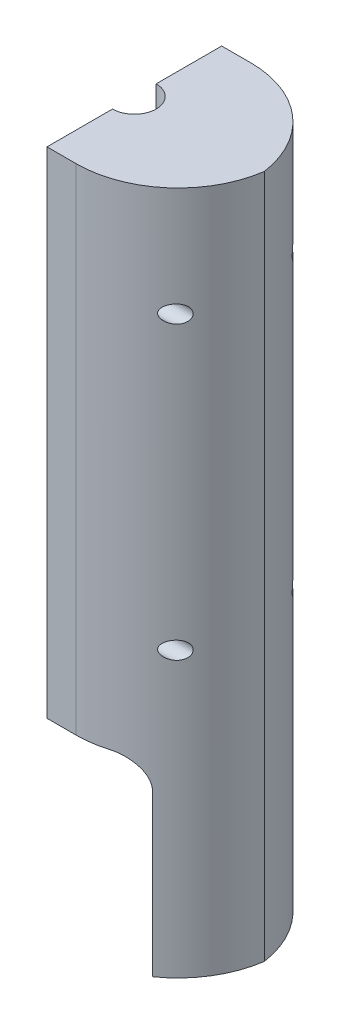
from build123d import *

# Parameters (mm, degrees)
BOSS_EXTRU_1_DEPTH            = 60
CONG_4_R                      = 35
CONG_5_R                      = 35
CONG_6_R                      = 35
CONG_12_R                     = 10
ENL_V_MAT_EXTRU_8_DEPTH       = 251
ESQUISSE6_R                   = 2
ENL_V_MAT_EXTRU_9_DEPTH       = 58
ENL_V_MAT_EXTRU_12_DEPTH      = 256.753178134
ENL_V_MAT_EXTRU_12_DEPTH_BACK = 179
COQUE1_T                      = -5
ENL_V_START                   = 20
ESQUISSE11_R                  = 3
ESQUISSE11_R_2                = 2
ENL_V_MAT_EXTRU_14_DEPTH      = 20
BOSS_EXTRU_2_DEPTH            = 5
ESQUISSE13_W                  = 8
ESQUISSE13_H                  = 11
ESQUISSE13_H_2                = 8
ESQUISSE13_W_2                = 11
ENL_V_MAT_EXTRU_15_DEPTH      = 4


with BuildPart() as part:
    # Esquisse1 → Boss.-Extru.1 (new body)
    with BuildSketch(Plane.XY):
        Polygon((-139.391143911, 131.10701107), (-139.391143911, -98.89298893), (-124.391143911, -98.89298893), (-124.391143911, -33.89298893), (-64.391143911, -33.89298893), (-64.391143911, -98.89298893), (-49.391143911, -98.89298893), (-49.391143911, 131.10701107), align=None)
    extrude(amount=BOSS_EXTRU_1_DEPTH)

    # Congé4
    cong_4_edges = [part.edges().sort_by_distance(p)[0] for p in [
        (-139.391143911, 16.10701107, 60),
    ]]
    fillet(cong_4_edges, radius=CONG_4_R)

    # Congé5
    # the kernel refuses this fillet: 35 mm, written as the material it takes off along each edge
    with BuildSketch(Plane(origin=(-139.391143911, 214.959560226, 0), x_dir=(0, 0, 1), z_dir=(0, -1, 0))) as cong_5_piece_1:
        with BuildLine():
            CenterArc((35, -33.541019662), CONG_5_R, 106.601549599, 73.398450401)
            Line((0, -33.541019662), (-0.7, -33.541019662))
            Line((-0.7, -33.541019662), (-0.7, 0))
            Line((-0.7, 0), (0, 0.7))
            ThreePointArc((0, 0.7), (12.5, 0.7), (24.8, 0.670820393))
            Line((24.8, 0.670820393), (25, 0))
        make_face()
    extrude(amount=397.705098312, mode=Mode.SUBTRACT)

    # Congé6
    # the kernel refuses this fillet: 35 mm, written as the material it takes off along each edge
    with BuildSketch(Plane(origin=(-49.391143911, -186.39298893, 0), x_dir=(-1, 0, 0), z_dir=(0, 1, 0))) as cong_6_piece_1:
        with BuildLine():
            CenterArc((CONG_6_R, CONG_6_R), CONG_6_R, 180, 90)
            Line((0, CONG_6_R), (0, 0))
            Line((0, 0), (CONG_6_R, 0))
        make_face()
    extrude(amount=405, mode=Mode.SUBTRACT)
    with BuildSketch(Plane(origin=(-49.391143911, -186.39298893, 60), x_dir=(-1, 0, 0), z_dir=(0, 1, 0))) as cong_6_piece_2:
        with BuildLine():
            CenterArc((CONG_6_R, -CONG_6_R), CONG_6_R, 90, 90)
            Line((0, -CONG_6_R), (0, 0))
            Line((0, 0), (CONG_6_R, 0))
        make_face()
    extrude(amount=405, mode=Mode.SUBTRACT)

    # Congé12
    cong_12_edges = [part.edges().sort_by_distance(p)[0] for p in [
        (-124.391143911, -33.89298893, 29.518642471),
        (-64.391143911, -33.89298893, 30),
    ]]
    fillet(cong_12_edges, radius=CONG_12_R)

    # Esquisse5 → Enlèv. mat.-Extru.8 (cut)
    with BuildSketch(Plane(origin=(0, 131.10701107, 0), x_dir=(1, 0, 0), z_dir=(0, 1, 0))):
        with BuildLine():
            Line((-94.391143911, -60), (-94.391143911, 0))
            ThreePointArc((-94.391143911, 0), (-165.244647607, -30), (-94.391143911, -60))
        make_face()
    extrude(amount=-ENL_V_MAT_EXTRU_8_DEPTH, mode=Mode.SUBTRACT)

    # Esquisse6 → Enlèv. mat.-Extru.9 (cut)
    with BuildSketch(Plane.ZY.offset(94.391143911)):
        with Locations((10, 98.60701107)):
            Circle(ESQUISSE6_R)
        with Locations((50, 98.60701107)):
            Circle(ESQUISSE6_R)
        with Locations((50, -1.39298893)):
            Circle(ESQUISSE6_R)
        with Locations((10, -1.39298893)):
            Circle(ESQUISSE6_R)
    extrude(amount=-ENL_V_MAT_EXTRU_9_DEPTH, mode=Mode.SUBTRACT)

    # Esquisse9 → Enlèv. mat.-Extru.12 (cut, two sides: drawn at the far end of the back side and taken through both)
    with BuildSketch(Plane(origin=(0, 131.10701107, 0), x_dir=(1, 0, 0), z_dir=(0, 1, 0)).offset(-ENL_V_MAT_EXTRU_12_DEPTH_BACK)):
        with BuildLine():
            Line((-220.994237172, -22.5), (-94.391143911, -22.5))
            ThreePointArc((-94.391143911, -22.5), (-86.891143911, -30), (-94.391143911, -37.5))
            Line((-94.391143911, -37.5), (-220.994237172, -37.5))
            Line((-220.994237172, -37.5), (-474.200423692, -37.5))
            Line((-474.200423692, -37.5), (-474.200423692, -22.5))
            Line((-474.200423692, -22.5), (-220.994237172, -22.5))
        make_face()
    extrude(amount=ENL_V_MAT_EXTRU_12_DEPTH + ENL_V_MAT_EXTRU_12_DEPTH_BACK, mode=Mode.SUBTRACT)

    # Coque1
    coque1_openings = [part.faces().sort_by_distance(p)[0] for p in [
        (-74.759269285, 131.10701107, 30),
    ]]
    offset(amount=COQUE1_T, openings=coque1_openings)

    # Esquisse11 → Enlèv. mat.-Extru.14 (cut)
    # profile 1 of 4: a face of its own
    with BuildSketch(Plane.ZY.offset(49.75012776).offset(ENL_V_START)):
        with Locations(Location((50, 98.60701107, 0), (0, 0, 180))):
            Circle(ESQUISSE11_R)
        with Locations((50, 98.60701107)):
            Circle(ESQUISSE11_R_2, mode=Mode.SUBTRACT)
    # profile 2 of 4: a face of its own
    with BuildSketch(Plane.ZY.offset(49.75012776).offset(ENL_V_START)):
        with Locations(Location((10, 98.60701107, 0), (0, 0, 180))):
            Circle(ESQUISSE11_R)
        with Locations((10, 98.60701107)):
            Circle(ESQUISSE11_R_2, mode=Mode.SUBTRACT)
    # profile 3 of 4: a face of its own
    with BuildSketch(Plane.ZY.offset(49.75012776).offset(ENL_V_START)):
        with Locations(Location((50, -1.39298893, 0), (0, 0, 180))):
            Circle(ESQUISSE11_R)
        with Locations((50, -1.39298893)):
            Circle(ESQUISSE11_R_2, mode=Mode.SUBTRACT)
    # profile 4 of 4: a face of its own
    with BuildSketch(Plane.ZY.offset(49.75012776).offset(ENL_V_START)):
        with Locations(Location((10, -1.39298893, 0), (0, 0, 180))):
            Circle(ESQUISSE11_R)
        with Locations((10, -1.39298893)):
            Circle(ESQUISSE11_R_2, mode=Mode.SUBTRACT)
    extrude(amount=-ENL_V_MAT_EXTRU_14_DEPTH, mode=Mode.SUBTRACT)

    # Esquisse12 → Boss.-Extru.2 (add)
    with BuildSketch(Plane(origin=(0, 131.10701107, 0), x_dir=(1, 0, 0), z_dir=(0, 1, 0))):
        with BuildLine():
            Line((-84.391143911, 0), (-94.391143911, 0))
            Line((-94.391143911, 0), (-94.391143911, -22.5))
            ThreePointArc((-94.391143911, -22.5), (-86.891143911, -30), (-94.391143911, -37.5))
            Line((-94.391143911, -37.5), (-94.391143911, -60))
            Line((-94.391143911, -60), (-84.391143911, -60))
            ThreePointArc((-84.391143911, -60), (-61.478265437, -51.457513111), (-49.75012776, -30))
            ThreePointArc((-49.75012776, -30), (-61.478265437, -8.542486889), (-84.391143911, 0))
        make_face()
    extrude(amount=BOSS_EXTRU_2_DEPTH)

    # Esquisse13 → Enlèv. mat.-Extru.15 (cut)
    with BuildSketch(Plane.ZY.offset(64.391143911)):
        with Locations((30, -61.89298893)):
            Rectangle(ESQUISSE13_W, ESQUISSE13_H)
        with Locations((30, -71.39298893)):
            Rectangle(ESQUISSE13_W, ESQUISSE13_H_2)
        with Locations((20.5, -71.39298893)):
            Rectangle(ESQUISSE13_W_2, ESQUISSE13_H_2)
        with Locations((39.5, -71.39298893)):
            Rectangle(ESQUISSE13_W_2, ESQUISSE13_H_2)
        with Locations((30, -80.89298893)):
            Rectangle(ESQUISSE13_W, ESQUISSE13_H)
    extrude(amount=-ENL_V_MAT_EXTRU_15_DEPTH, mode=Mode.SUBTRACT)


solid = part.part
